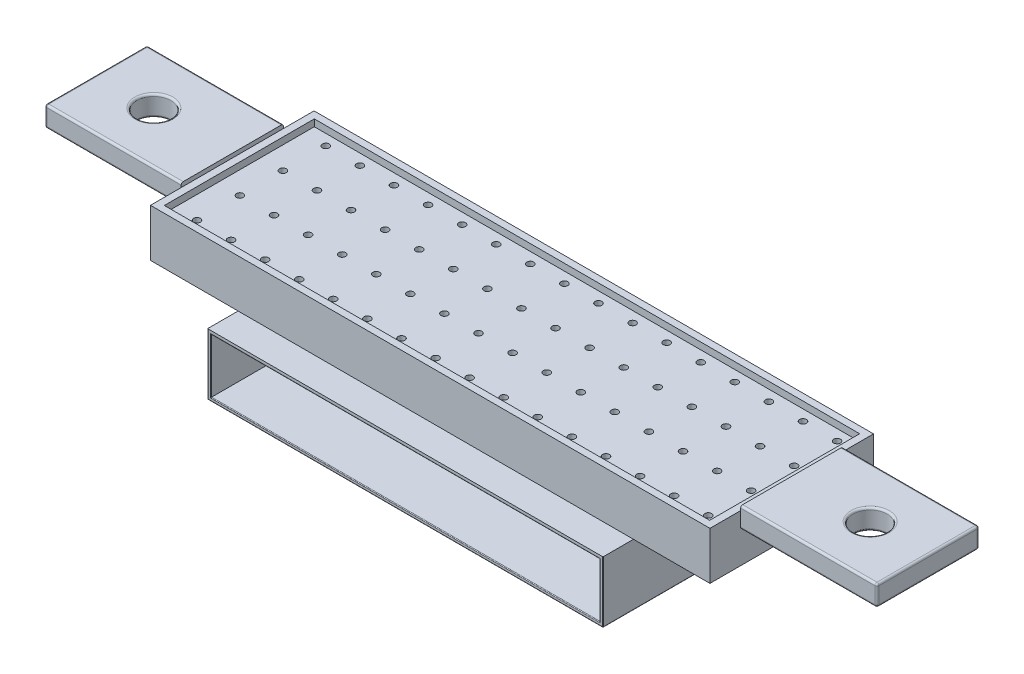
from build123d import *

# Parameters (mm, degrees)
SKETCH1_W           = 80
SKETCH1_H           = 22
SKETCH1_R           = 0.5
BOSS_EXTRUDE1_DEPTH = 5
BOSS_EXTRUDE2_START = -1
SKETCH6_W           = 82
SKETCH6_H           = 24
SKETCH6_W_2         = 80
SKETCH6_H_2         = 22
BOSS_EXTRUDE2_DEPTH = 7
SKETCH7_W           = 15
SKETCH7_H           = 3
BOSS_EXTRUDE3_DEPTH = 20
SKETCH8_R           = 2.5
CUT_EXTRUDE1_DEPTH  = 104.901468557
FILLET1_R           = 0.3
SKETCH10_W          = 58
SKETCH10_H          = 32
BOSS_EXTRUDE4_DEPTH = 9
SHELL1_START        = -9.5
SHELL1_OUTLINE_W    = 57
SHELL1_OUTLINE_H    = 31.5
SHELL1_DEPTH        = 8
SHELL1_START_2      = 0.5
SHELL1_2_OUTLINE_W  = 81.075214662
SHELL1_2_OUTLINE_H  = 23
SHELL1_2_OUTLINE_R  = 1
SHELL1_2_DEPTH      = 4
SHELL1_START_3      = 4.110326736
SHELL1_3_OUTLINE_W  = 19
SHELL1_3_OUTLINE_H  = 14
SHELL1_3_OUTLINE_R  = 3
SHELL1_3_DEPTH      = 2
SHELL1_4_DEPTH      = 1.389673264
SHELL1_START_4      = -0.5
SHELL1_5_OUTLINE_W  = 0.037607331
SHELL1_5_OUTLINE_H  = 23
SHELL1_5_DEPTH      = 1
FILLET2_R           = 0.1


# Read off the part's stored shape, not the designer's step: Shell1
with BuildPart() as part:
    # Sketch1 → Boss-Extrude1 (new body)
    with BuildSketch(Plane(origin=(0, 0, 0), x_dir=(1, 0, 0), z_dir=(0, 1, 0))):
        with Locations((40, 11)):
            Rectangle(SKETCH1_W, SKETCH1_H)
        with Locations(Location((78.276716264, 1.510550974, 0), (0, 0, 270))):
            Circle(SKETCH1_R, mode=Mode.SUBTRACT)
        with Locations(Location((73.276716264, 1.510550974, 0), (0, 0, 270))):
            Circle(SKETCH1_R, mode=Mode.SUBTRACT)
        with Locations(Location((68.276716264, 1.510550974, 0), (0, 0, 270))):
            Circle(SKETCH1_R, mode=Mode.SUBTRACT)
        with Locations(Location((63.276716264, 1.510550974, 0), (0, 0, 270))):
            Circle(SKETCH1_R, mode=Mode.SUBTRACT)
        with Locations(Location((58.276716264, 1.510550974, 0), (0, 0, 270))):
            Circle(SKETCH1_R, mode=Mode.SUBTRACT)
        with Locations(Location((53.276716264, 1.510550974, 0), (0, 0, 270))):
            Circle(SKETCH1_R, mode=Mode.SUBTRACT)
        with Locations(Location((48.276716264, 1.510550974, 0), (0, 0, 270))):
            Circle(SKETCH1_R, mode=Mode.SUBTRACT)
        with Locations(Location((43.276716264, 1.510550974, 0), (0, 0, 270))):
            Circle(SKETCH1_R, mode=Mode.SUBTRACT)
        with Locations(Location((38.276716264, 1.510550974, 0), (0, 0, 270))):
            Circle(SKETCH1_R, mode=Mode.SUBTRACT)
        with Locations(Location((33.276716264, 1.510550974, 0), (0, 0, 270))):
            Circle(SKETCH1_R, mode=Mode.SUBTRACT)
        with Locations(Location((28.276716264, 1.510550974, 0), (0, 0, 270))):
            Circle(SKETCH1_R, mode=Mode.SUBTRACT)
        with Locations(Location((23.276716264, 1.510550974, 0), (0, 0, 270))):
            Circle(SKETCH1_R, mode=Mode.SUBTRACT)
        with Locations(Location((18.276716264, 1.510550974, 0), (0, 0, 270))):
            Circle(SKETCH1_R, mode=Mode.SUBTRACT)
        with Locations(Location((13.276716264, 1.510550974, 0), (0, 0, 270))):
            Circle(SKETCH1_R, mode=Mode.SUBTRACT)
        with Locations(Location((8.276716264, 1.510550974, 0), (0, 0, 270))):
            Circle(SKETCH1_R, mode=Mode.SUBTRACT)
        with Locations(Location((3.276716264, 1.510550974, 0), (0, 0, 270))):
            Circle(SKETCH1_R, mode=Mode.SUBTRACT)
        with Locations(Location((73.276716264, 7.810550974, 0), (0, 0, 270))):
            Circle(SKETCH1_R, mode=Mode.SUBTRACT)
        with Locations(Location((68.276716264, 7.810550974, 0), (0, 0, 270))):
            Circle(SKETCH1_R, mode=Mode.SUBTRACT)
        with Locations(Location((63.276716264, 7.810550974, 0), (0, 0, 270))):
            Circle(SKETCH1_R, mode=Mode.SUBTRACT)
        with Locations(Location((58.276716264, 7.810550974, 0), (0, 0, 270))):
            Circle(SKETCH1_R, mode=Mode.SUBTRACT)
        with Locations(Location((53.276716264, 7.810550974, 0), (0, 0, 270))):
            Circle(SKETCH1_R, mode=Mode.SUBTRACT)
        with Locations(Location((48.276716264, 7.810550974, 0), (0, 0, 270))):
            Circle(SKETCH1_R, mode=Mode.SUBTRACT)
        with Locations(Location((43.276716264, 7.810550974, 0), (0, 0, 270))):
            Circle(SKETCH1_R, mode=Mode.SUBTRACT)
        with Locations(Location((38.276716264, 7.810550974, 0), (0, 0, 270))):
            Circle(SKETCH1_R, mode=Mode.SUBTRACT)
        with Locations(Location((33.276716264, 7.810550974, 0), (0, 0, 270))):
            Circle(SKETCH1_R, mode=Mode.SUBTRACT)
        with Locations(Location((28.276716264, 7.810550974, 0), (0, 0, 270))):
            Circle(SKETCH1_R, mode=Mode.SUBTRACT)
        with Locations(Location((23.276716264, 7.810550974, 0), (0, 0, 270))):
            Circle(SKETCH1_R, mode=Mode.SUBTRACT)
        with Locations(Location((18.276716264, 7.810550974, 0), (0, 0, 270))):
            Circle(SKETCH1_R, mode=Mode.SUBTRACT)
        with Locations(Location((13.276716264, 7.810550974, 0), (0, 0, 270))):
            Circle(SKETCH1_R, mode=Mode.SUBTRACT)
        with Locations(Location((8.276716264, 7.810550974, 0), (0, 0, 270))):
            Circle(SKETCH1_R, mode=Mode.SUBTRACT)
        with Locations(Location((3.276716264, 7.810550974, 0), (0, 0, 270))):
            Circle(SKETCH1_R, mode=Mode.SUBTRACT)
        with Locations(Location((73.276716264, 14.110550974, 0), (0, 0, 270))):
            Circle(SKETCH1_R, mode=Mode.SUBTRACT)
        with Locations(Location((68.276716264, 14.110550974, 0), (0, 0, 270))):
            Circle(SKETCH1_R, mode=Mode.SUBTRACT)
        with Locations(Location((63.276716264, 14.110550974, 0), (0, 0, 270))):
            Circle(SKETCH1_R, mode=Mode.SUBTRACT)
        with Locations(Location((58.276716264, 14.110550974, 0), (0, 0, 270))):
            Circle(SKETCH1_R, mode=Mode.SUBTRACT)
        with Locations(Location((53.276716264, 14.110550974, 0), (0, 0, 270))):
            Circle(SKETCH1_R, mode=Mode.SUBTRACT)
        with Locations(Location((48.276716264, 14.110550974, 0), (0, 0, 270))):
            Circle(SKETCH1_R, mode=Mode.SUBTRACT)
        with Locations(Location((43.276716264, 14.110550974, 0), (0, 0, 270))):
            Circle(SKETCH1_R, mode=Mode.SUBTRACT)
        with Locations(Location((38.276716264, 14.110550974, 0), (0, 0, 270))):
            Circle(SKETCH1_R, mode=Mode.SUBTRACT)
        with Locations(Location((33.276716264, 14.110550974, 0), (0, 0, 270))):
            Circle(SKETCH1_R, mode=Mode.SUBTRACT)
        with Locations(Location((28.276716264, 14.110550974, 0), (0, 0, 270))):
            Circle(SKETCH1_R, mode=Mode.SUBTRACT)
        with Locations(Location((23.276716264, 14.110550974, 0), (0, 0, 270))):
            Circle(SKETCH1_R, mode=Mode.SUBTRACT)
        with Locations(Location((18.276716264, 14.110550974, 0), (0, 0, 270))):
            Circle(SKETCH1_R, mode=Mode.SUBTRACT)
        with Locations(Location((13.276716264, 14.110550974, 0), (0, 0, 270))):
            Circle(SKETCH1_R, mode=Mode.SUBTRACT)
        with Locations(Location((8.276716264, 14.110550974, 0), (0, 0, 270))):
            Circle(SKETCH1_R, mode=Mode.SUBTRACT)
        with Locations(Location((3.276716264, 14.110550974, 0), (0, 0, 270))):
            Circle(SKETCH1_R, mode=Mode.SUBTRACT)
        with Locations(Location((73.276716264, 20.410550974, 0), (0, 0, 270))):
            Circle(SKETCH1_R, mode=Mode.SUBTRACT)
        with Locations(Location((68.276716264, 20.410550974, 0), (0, 0, 270))):
            Circle(SKETCH1_R, mode=Mode.SUBTRACT)
        with Locations(Location((63.276716264, 20.410550974, 0), (0, 0, 270))):
            Circle(SKETCH1_R, mode=Mode.SUBTRACT)
        with Locations(Location((58.276716264, 20.410550974, 0), (0, 0, 270))):
            Circle(SKETCH1_R, mode=Mode.SUBTRACT)
        with Locations(Location((53.276716264, 20.410550974, 0), (0, 0, 270))):
            Circle(SKETCH1_R, mode=Mode.SUBTRACT)
        with Locations(Location((48.276716264, 20.410550974, 0), (0, 0, 270))):
            Circle(SKETCH1_R, mode=Mode.SUBTRACT)
        with Locations(Location((43.276716264, 20.410550974, 0), (0, 0, 270))):
            Circle(SKETCH1_R, mode=Mode.SUBTRACT)
        with Locations(Location((38.276716264, 20.410550974, 0), (0, 0, 270))):
            Circle(SKETCH1_R, mode=Mode.SUBTRACT)
        with Locations(Location((33.276716264, 20.410550974, 0), (0, 0, 270))):
            Circle(SKETCH1_R, mode=Mode.SUBTRACT)
        with Locations(Location((28.276716264, 20.410550974, 0), (0, 0, 270))):
            Circle(SKETCH1_R, mode=Mode.SUBTRACT)
        with Locations(Location((23.276716264, 20.410550974, 0), (0, 0, 270))):
            Circle(SKETCH1_R, mode=Mode.SUBTRACT)
        with Locations(Location((18.276716264, 20.410550974, 0), (0, 0, 270))):
            Circle(SKETCH1_R, mode=Mode.SUBTRACT)
        with Locations(Location((13.276716264, 20.410550974, 0), (0, 0, 270))):
            Circle(SKETCH1_R, mode=Mode.SUBTRACT)
        with Locations(Location((8.276716264, 20.410550974, 0), (0, 0, 270))):
            Circle(SKETCH1_R, mode=Mode.SUBTRACT)
        with Locations(Location((3.276716264, 20.410550974, 0), (0, 0, 270))):
            Circle(SKETCH1_R, mode=Mode.SUBTRACT)
        with Locations(Location((78.276716264, 7.810550974, 0), (0, 0, 270))):
            Circle(SKETCH1_R, mode=Mode.SUBTRACT)
        with Locations(Location((78.276716264, 14.110550974, 0), (0, 0, 270))):
            Circle(SKETCH1_R, mode=Mode.SUBTRACT)
        with Locations(Location((78.276716264, 20.410550974, 0), (0, 0, 270))):
            Circle(SKETCH1_R, mode=Mode.SUBTRACT)
    extrude(amount=BOSS_EXTRUDE1_DEPTH)

    # Sketch6 → Boss-Extrude2 (add)
    with BuildSketch(Plane(origin=(0, 0, 0), x_dir=(1, 0, 0), z_dir=(0, 1, 0)).offset(BOSS_EXTRUDE2_START)):
        with Locations((39.962392669, 11)):
            Rectangle(SKETCH6_W, SKETCH6_H)
        with Locations((40, 11)):
            Rectangle(SKETCH6_W_2, SKETCH6_H_2, mode=Mode.SUBTRACT)
    boss_extrude2 = extrude(amount=BOSS_EXTRUDE2_DEPTH)

    # Sketch7 → Boss-Extrude3 (add)
    with BuildSketch(Plane.ZY.offset(1.037607331)):
        with Locations((-11, 5.110326736)):
            Rectangle(SKETCH7_W, SKETCH7_H)
    boss_extrude3 = extrude(amount=BOSS_EXTRUDE3_DEPTH)

    # Mirror2: Boss-Extrude2, Boss-Extrude3 across plane
    add(boss_extrude2.mirror(Plane(origin=(40, 0, 0), x_dir=(0, 0, 1), z_dir=(1, 0, 0))))
    add(boss_extrude3.mirror(Plane(origin=(40, 0, 0), x_dir=(0, 0, 1), z_dir=(1, 0, 0))))

    # Sketch8 → Cut-Extrude1 (cut, through all)
    with BuildSketch(Plane(origin=(0, 6.610326736, 0), x_dir=(1, 0, 0), z_dir=(0, 1, 0))):
        with Locations(Location((-12.537607331, 11, 0), (0, 0, 270))):
            Circle(SKETCH8_R)
    cut_extrude1 = extrude(amount=-CUT_EXTRUDE1_DEPTH, mode=Mode.SUBTRACT)

    # Mirror3: Cut-Extrude1 across plane
    add(cut_extrude1.mirror(Plane(origin=(40, 0, 0), x_dir=(0, 0, 1), z_dir=(1, 0, 0))), mode=Mode.SUBTRACT)

    # Fillet1
    fillet1_edges = [part.edges().sort_by_distance(p)[0] for p in [
        (-11.037607331, 3.610326736, -3.5),
        (-11.037607331, 6.610326736, -3.5),
        (-11.037607331, 6.610326736, -18.5),
        (-11.037607331, 3.610326736, -18.5),
        (-21.037607331, 5.110326736, -3.5),
        (-21.037607331, 6.610326736, -11),
        (-21.037607331, 5.110326736, -18.5),
        (-21.037607331, 3.610326736, -11),
        (101.037607331, 5.110326736, -3.5),
        (91.037607331, 6.610326736, -3.5),
        (101.037607331, 3.610326736, -11),
        (91.037607331, 3.610326736, -3.5),
        (101.037607331, 5.110326736, -18.5),
        (91.037607331, 3.610326736, -18.5),
        (101.037607331, 6.610326736, -11),
        (91.037607331, 6.610326736, -18.5),
        (-12.537607331, 3.610326736, -13.5),
        (-12.537607331, 6.610326736, -13.5),
        (92.537607331, 3.610326736, -13.5),
        (92.537607331, 6.610326736, -13.5),
    ]]
    fillet(fillet1_edges, radius=FILLET1_R)

    # Sketch10 → Boss-Extrude4 (add)
    with BuildSketch(Plane(origin=(0, -1, 0), x_dir=(1, 0, 0), z_dir=(0, 1, 0))):
        with Locations((40.819120301, 10.527322686)):
            Rectangle(SKETCH10_W, SKETCH10_H)
    extrude(amount=-BOSS_EXTRUDE4_DEPTH)

    # Shell1 outline → Shell1 (cut)
    with BuildSketch(Plane(origin=(0, 0, 0), x_dir=(1, 0, 0), z_dir=(0, 1, 0)).offset(SHELL1_START)):
        with Locations((40.819120301, 10.277322686)):
            Rectangle(SHELL1_OUTLINE_W, SHELL1_OUTLINE_H)
    extrude(amount=SHELL1_DEPTH, mode=Mode.SUBTRACT)

    # Shell1 2 outline → Shell1 2 (cut)
    with BuildSketch(Plane(origin=(0, 0, 0), x_dir=(1, 0, 0), z_dir=(0, 1, 0)).offset(SHELL1_START_2)):
        with Locations((40, 11)):
            Rectangle(SHELL1_2_OUTLINE_W, SHELL1_2_OUTLINE_H)
        with Locations((13.276716264, 1.510550974)):
            Circle(SHELL1_2_OUTLINE_R, mode=Mode.SUBTRACT)
        with Locations((13.276716264, 7.810550974)):
            Circle(SHELL1_2_OUTLINE_R, mode=Mode.SUBTRACT)
        with Locations((13.276716264, 14.110550974)):
            Circle(SHELL1_2_OUTLINE_R, mode=Mode.SUBTRACT)
        with Locations((13.276716264, 20.410550974)):
            Circle(SHELL1_2_OUTLINE_R, mode=Mode.SUBTRACT)
        with Locations((18.276716264, 1.510550974)):
            Circle(SHELL1_2_OUTLINE_R, mode=Mode.SUBTRACT)
        with Locations((23.276716264, 1.510550974)):
            Circle(SHELL1_2_OUTLINE_R, mode=Mode.SUBTRACT)
        with Locations((28.276716264, 1.510550974)):
            Circle(SHELL1_2_OUTLINE_R, mode=Mode.SUBTRACT)
        with Locations((33.276716264, 1.510550974)):
            Circle(SHELL1_2_OUTLINE_R, mode=Mode.SUBTRACT)
        with Locations((38.276716264, 1.510550974)):
            Circle(SHELL1_2_OUTLINE_R, mode=Mode.SUBTRACT)
        with Locations((18.276716264, 7.810550974)):
            Circle(SHELL1_2_OUTLINE_R, mode=Mode.SUBTRACT)
        with Locations((23.276716264, 7.810550974)):
            Circle(SHELL1_2_OUTLINE_R, mode=Mode.SUBTRACT)
        with Locations((28.276716264, 7.810550974)):
            Circle(SHELL1_2_OUTLINE_R, mode=Mode.SUBTRACT)
        with Locations((33.276716264, 7.810550974)):
            Circle(SHELL1_2_OUTLINE_R, mode=Mode.SUBTRACT)
        with Locations((38.276716264, 7.810550974)):
            Circle(SHELL1_2_OUTLINE_R, mode=Mode.SUBTRACT)
        with Locations((43.276716264, 1.510550974)):
            Circle(SHELL1_2_OUTLINE_R, mode=Mode.SUBTRACT)
        with Locations((48.276716264, 1.510550974)):
            Circle(SHELL1_2_OUTLINE_R, mode=Mode.SUBTRACT)
        with Locations((53.276716264, 1.510550974)):
            Circle(SHELL1_2_OUTLINE_R, mode=Mode.SUBTRACT)
        with Locations((58.276716264, 1.510550974)):
            Circle(SHELL1_2_OUTLINE_R, mode=Mode.SUBTRACT)
        with Locations((63.276716264, 1.510550974)):
            Circle(SHELL1_2_OUTLINE_R, mode=Mode.SUBTRACT)
        with Locations((68.276716264, 1.510550974)):
            Circle(SHELL1_2_OUTLINE_R, mode=Mode.SUBTRACT)
        with Locations((43.276716264, 7.810550974)):
            Circle(SHELL1_2_OUTLINE_R, mode=Mode.SUBTRACT)
        with Locations((48.276716264, 7.810550974)):
            Circle(SHELL1_2_OUTLINE_R, mode=Mode.SUBTRACT)
        with Locations((53.276716264, 7.810550974)):
            Circle(SHELL1_2_OUTLINE_R, mode=Mode.SUBTRACT)
        with Locations((58.276716264, 7.810550974)):
            Circle(SHELL1_2_OUTLINE_R, mode=Mode.SUBTRACT)
        with Locations((63.276716264, 7.810550974)):
            Circle(SHELL1_2_OUTLINE_R, mode=Mode.SUBTRACT)
        with Locations((68.276716264, 7.810550974)):
            Circle(SHELL1_2_OUTLINE_R, mode=Mode.SUBTRACT)
        with Locations((18.276716264, 14.110550974)):
            Circle(SHELL1_2_OUTLINE_R, mode=Mode.SUBTRACT)
        with Locations((23.276716264, 14.110550974)):
            Circle(SHELL1_2_OUTLINE_R, mode=Mode.SUBTRACT)
        with Locations((28.276716264, 14.110550974)):
            Circle(SHELL1_2_OUTLINE_R, mode=Mode.SUBTRACT)
        with Locations((33.276716264, 14.110550974)):
            Circle(SHELL1_2_OUTLINE_R, mode=Mode.SUBTRACT)
        with Locations((38.276716264, 14.110550974)):
            Circle(SHELL1_2_OUTLINE_R, mode=Mode.SUBTRACT)
        with Locations((18.276716264, 20.410550974)):
            Circle(SHELL1_2_OUTLINE_R, mode=Mode.SUBTRACT)
        with Locations((23.276716264, 20.410550974)):
            Circle(SHELL1_2_OUTLINE_R, mode=Mode.SUBTRACT)
        with Locations((28.276716264, 20.410550974)):
            Circle(SHELL1_2_OUTLINE_R, mode=Mode.SUBTRACT)
        with Locations((33.276716264, 20.410550974)):
            Circle(SHELL1_2_OUTLINE_R, mode=Mode.SUBTRACT)
        with Locations((38.276716264, 20.410550974)):
            Circle(SHELL1_2_OUTLINE_R, mode=Mode.SUBTRACT)
        with Locations((43.276716264, 14.110550974)):
            Circle(SHELL1_2_OUTLINE_R, mode=Mode.SUBTRACT)
        with Locations((48.276716264, 14.110550974)):
            Circle(SHELL1_2_OUTLINE_R, mode=Mode.SUBTRACT)
        with Locations((53.276716264, 14.110550974)):
            Circle(SHELL1_2_OUTLINE_R, mode=Mode.SUBTRACT)
        with Locations((58.276716264, 14.110550974)):
            Circle(SHELL1_2_OUTLINE_R, mode=Mode.SUBTRACT)
        with Locations((63.276716264, 14.110550974)):
            Circle(SHELL1_2_OUTLINE_R, mode=Mode.SUBTRACT)
        with Locations((68.276716264, 14.110550974)):
            Circle(SHELL1_2_OUTLINE_R, mode=Mode.SUBTRACT)
        with Locations((43.276716264, 20.410550974)):
            Circle(SHELL1_2_OUTLINE_R, mode=Mode.SUBTRACT)
        with Locations((48.276716264, 20.410550974)):
            Circle(SHELL1_2_OUTLINE_R, mode=Mode.SUBTRACT)
        with Locations((53.276716264, 20.410550974)):
            Circle(SHELL1_2_OUTLINE_R, mode=Mode.SUBTRACT)
        with Locations((58.276716264, 20.410550974)):
            Circle(SHELL1_2_OUTLINE_R, mode=Mode.SUBTRACT)
        with Locations((63.276716264, 20.410550974)):
            Circle(SHELL1_2_OUTLINE_R, mode=Mode.SUBTRACT)
        with Locations((68.276716264, 20.410550974)):
            Circle(SHELL1_2_OUTLINE_R, mode=Mode.SUBTRACT)
        with Locations((78.276716264, 20.410550974)):
            Circle(SHELL1_2_OUTLINE_R, mode=Mode.SUBTRACT)
        with Locations((73.276716264, 1.510550974)):
            Circle(SHELL1_2_OUTLINE_R, mode=Mode.SUBTRACT)
        with Locations((78.276716264, 1.510550974)):
            Circle(SHELL1_2_OUTLINE_R, mode=Mode.SUBTRACT)
        with Locations((73.276716264, 7.810550974)):
            Circle(SHELL1_2_OUTLINE_R, mode=Mode.SUBTRACT)
        with Locations((78.276716264, 7.810550974)):
            Circle(SHELL1_2_OUTLINE_R, mode=Mode.SUBTRACT)
        with Locations((73.276716264, 14.110550974)):
            Circle(SHELL1_2_OUTLINE_R, mode=Mode.SUBTRACT)
        with Locations((78.276716264, 14.110550974)):
            Circle(SHELL1_2_OUTLINE_R, mode=Mode.SUBTRACT)
        with Locations((73.276716264, 20.410550974)):
            Circle(SHELL1_2_OUTLINE_R, mode=Mode.SUBTRACT)
        with Locations((8.276716264, 7.810550974)):
            Circle(SHELL1_2_OUTLINE_R, mode=Mode.SUBTRACT)
        with Locations((3.276716264, 14.110550974)):
            Circle(SHELL1_2_OUTLINE_R, mode=Mode.SUBTRACT)
        with Locations((8.276716264, 14.110550974)):
            Circle(SHELL1_2_OUTLINE_R, mode=Mode.SUBTRACT)
        with Locations((3.276716264, 20.410550974)):
            Circle(SHELL1_2_OUTLINE_R, mode=Mode.SUBTRACT)
        with Locations((8.276716264, 20.410550974)):
            Circle(SHELL1_2_OUTLINE_R, mode=Mode.SUBTRACT)
        with Locations((3.276716264, 1.510550974)):
            Circle(SHELL1_2_OUTLINE_R, mode=Mode.SUBTRACT)
        with Locations((8.276716264, 1.510550974)):
            Circle(SHELL1_2_OUTLINE_R, mode=Mode.SUBTRACT)
        with Locations((3.276716264, 7.810550974)):
            Circle(SHELL1_2_OUTLINE_R, mode=Mode.SUBTRACT)
    extrude(amount=SHELL1_2_DEPTH, mode=Mode.SUBTRACT)

    # Shell1 3 outline → Shell1 3 (cut)
    # profile 1 of 2: a face of its own
    with BuildSketch(Plane(origin=(0, 0, 0), x_dir=(1, 0, 0), z_dir=(0, 1, 0)).offset(SHELL1_START_3)):
        with Locations((-11.037607331, 11)):
            Rectangle(SHELL1_3_OUTLINE_W, SHELL1_3_OUTLINE_H)
        with Locations((-12.537607331, 11)):
            Circle(SHELL1_3_OUTLINE_R, mode=Mode.SUBTRACT)
    # profile 2 of 2: a face of its own
    with BuildSketch(Plane(origin=(0, 0, 0), x_dir=(1, 0, 0), z_dir=(0, 1, 0)).offset(SHELL1_START_3)):
        with Locations((91.037607331, 11)):
            Rectangle(SHELL1_3_OUTLINE_W, SHELL1_3_OUTLINE_H)
        with Locations((92.537607331, 11)):
            Circle(SHELL1_3_OUTLINE_R, mode=Mode.SUBTRACT)
    extrude(amount=SHELL1_3_DEPTH, mode=Mode.SUBTRACT)

    # Shell1 4 outline → Shell1 4 (cut)
    with BuildSketch(Plane(origin=(0, 0, 0), x_dir=(1, 0, 0), z_dir=(0, 1, 0)).offset(SHELL1_START_3)):
        Polygon((-0.5, -0.5), (-0.5, 22.5), (-0.537607331, 22.5), (-0.537607331, 18), (-1.537607331, 18), (-1.537607331, 4), (-0.537607331, 4), (-0.537607331, -0.5), align=None)
        Polygon((80.537607331, 22.5), (80.5, 22.5), (80.5, -0.5), (80.537607331, -0.5), (80.537607331, 4), (81.537607331, 4), (81.537607331, 18), (80.537607331, 18), align=None)
    extrude(amount=SHELL1_4_DEPTH, mode=Mode.SUBTRACT)

    # Shell1 5 outline → Shell1 5 (cut)
    with BuildSketch(Plane(origin=(0, 0, 0), x_dir=(1, 0, 0), z_dir=(0, 1, 0)).offset(SHELL1_START_4)):
        with Locations((-0.518803666, 11)):
            Rectangle(SHELL1_5_OUTLINE_W, SHELL1_5_OUTLINE_H)
        with Locations((80.518803666, 11)):
            Rectangle(SHELL1_5_OUTLINE_W, SHELL1_5_OUTLINE_H)
    extrude(amount=SHELL1_5_DEPTH, mode=Mode.SUBTRACT)

    # Fillet2
    fillet2_edges = [part.edges().sort_by_distance(p)[0] for p in [
        (11.819120301, -10, -10.527322686),
        (11.819120301, -5.5, 5.472677314),
        (40.819120301, -10, -26.527322686),
        (11.819120301, -5.5, -26.527322686),
        (69.819120301, -10, -10.527322686),
        (69.819120301, -5.5, -26.527322686),
        (40.819120301, -10, 5.472677314),
        (69.819120301, -5.5, 5.472677314),
        (40.819120301, -1.5, 5.472677314),
        (12.319120301, -5.5, 5.472677314),
        (40.819120301, -9.5, 5.472677314),
        (69.319120301, -5.5, 5.472677314),
    ]]
    fillet(fillet2_edges, radius=FILLET2_R)


solid = part.part
